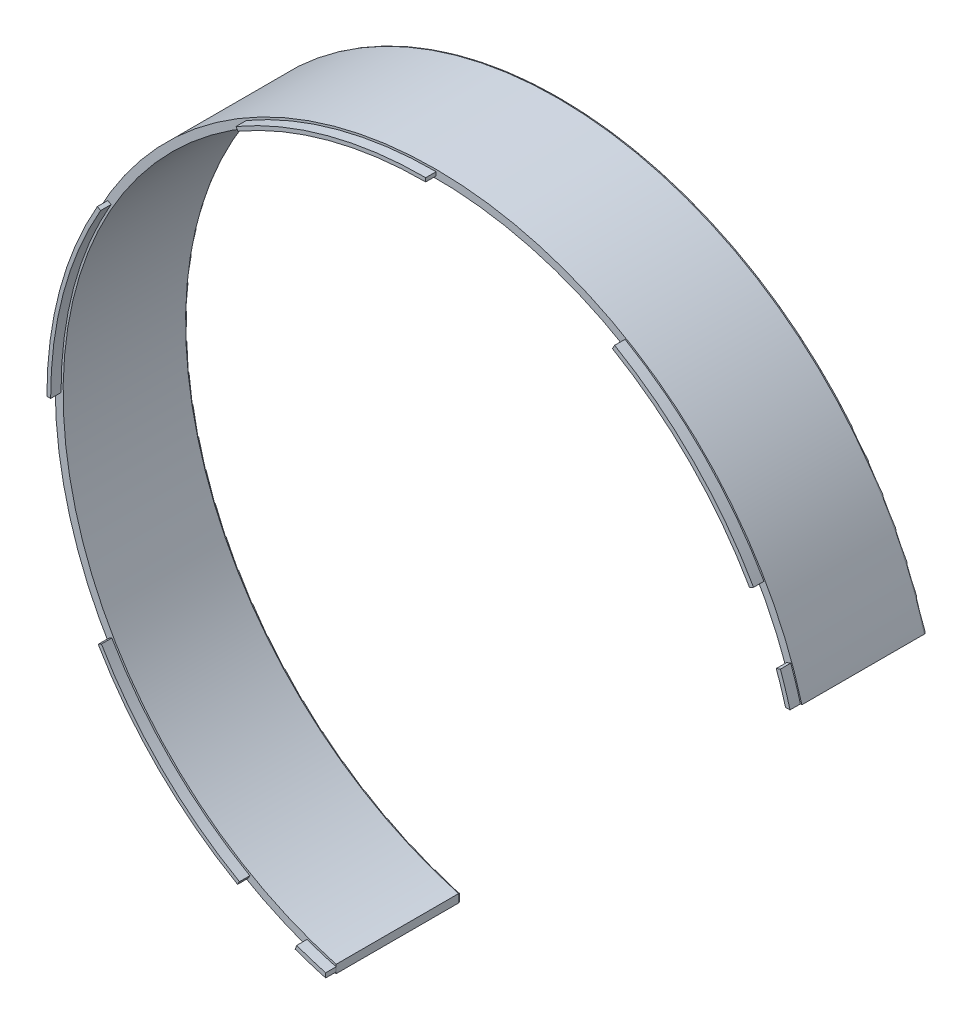
from build123d import *

# Parameters (mm, degrees)
BOSS_EXTRUDE1_DEPTH   = 5
BOSS_EXTRUDE1_2_DEPTH = 5
BOSS_EXTRUDE1_3_DEPTH = 5
BOSS_EXTRUDE1_4_DEPTH = 5
BOSS_EXTRUDE1_5_DEPTH = 5
BOSS_EXTRUDE1_6_DEPTH = 5
BOSS_EXTRUDE2_DEPTH   = 60
FILLET1_R             = 1
FILLET2_R             = 1


with BuildPart() as part:
    # Sketch1 → Boss-Extrude1 (new body)
    with BuildSketch(Plane.XY):
        with BuildLine():
            Line((158.382872448, 90.065008273), (156.470455766, 88.977505429))
            ThreePointArc((156.470455766, 88.977505429), (127.845298599, 126.710613707), (90.368878394, 155.671017912))
            Line((90.368878394, 155.671017912), (91.473386907, 157.573663687))
            ThreePointArc((91.473386907, 157.573663687), (129.407852249, 128.259298986), (158.382872448, 90.065008273))
        make_face()
    extrude(amount=-BOSS_EXTRUDE1_DEPTH)

    # Sketch2 → Boss-Extrude2 (add)
    with BuildSketch(Plane(origin=(0, 0, -5), x_dir=(-1, 0, 0), z_dir=(0, 0, -1))):
        with BuildLine():
            Line((47.7, -172.73491251), (47.7, -176.674021859))
            ThreePointArc((47.7, -176.674021859), (129.400540957, 129.400540957), (-176.674021859, 47.7))
            Line((-176.674021859, 47.7), (-172.73491251, 47.7))
            ThreePointArc((-172.73491251, 47.7), (126.713535189, 126.713535189), (47.7, -172.73491251))
        make_face()
    extrude(amount=BOSS_EXTRUDE2_DEPTH)

    # Fillet1
    fillet1_edges = [part.edges().sort_by_distance(p)[0] for p in [
        (-126.713535189, 126.713535189, -65),
        (-129.400540957, 129.400540957, -65),
        (174.704467185, 47.7, -65),
    ]]
    fillet(fillet1_edges, radius=FILLET1_R)

    # Fillet2
    # the kernel refuses this fillet: 1 mm, written as the material it takes off along each edge
    with BuildSketch(Plane(origin=(-47.7, -171.272370881, -65), x_dir=(0.0001000100005032703, 0, 0.9999999949989999), z_dir=(0, -1, 0))) as fillet2_piece_1:
        with BuildLine():
            CenterArc((0.999799995, 0.999999995), FILLET2_R, 180.005730151, 90)
            Line((-0.0002, 0.999899985), (-0.0202, 0.999897985))
            ThreePointArc((-0.0202, 0.999897985), (-0.02005, 0.499947997), (-0.02, -2e-06))
            Line((-0.02, -2e-06), (2e-06, -0.02))
            ThreePointArc((2e-06, -0.02), (0.499951998, -0.01995), (0.999902005, -0.02))
            Line((0.999902005, -0.02), (0.999900005, 0))
        make_face()
    extrude(amount=6.865387546, mode=Mode.SUBTRACT)


with BuildPart() as body_2:
    # Sketch1 → Boss-Extrude1 2 (new body)
    with BuildSketch(Plane.XY):
        with BuildLine():
            Line((169.319700725, 61.667486946), (171.292107151, 62.388332466))
            ThreePointArc((171.292107151, 62.388332466), (173.775741793, 55.093389478), (175.948856205, 47.7))
            Line((175.948856205, 47.7), (173.772120894, 47.7))
            ThreePointArc((173.772120894, 47.7), (171.688008284, 54.729039929), (169.319700725, 61.667486946))
        make_face()
    extrude(amount=-BOSS_EXTRUDE1_2_DEPTH)


with BuildPart() as body_3:
    # Sketch1 → Boss-Extrude1 3 (new body)
    with BuildSketch(Plane.XY):
        with BuildLine():
            Line((-90.895254799, 157.67705177), (-89.99457706, 156.118596265))
            ThreePointArc((-89.99457706, 156.118596265), (-46.351054078, 174.136784701), (0.474763766, 180.199374581))
            Line((0.474763766, 180.199374581), (0.481503909, 181.999363059))
            ThreePointArc((0.481503909, 181.999363059), (-46.814050179, 175.876219842), (-90.895254799, 157.67705177))
        make_face()
    extrude(amount=-BOSS_EXTRUDE1_3_DEPTH)


with BuildPart() as body_4:
    # Sketch1 → Boss-Extrude1 4 (new body)
    with BuildSketch(Plane.XY):
        with BuildLine():
            Line((-181.999363059, -0.481503909), (-180.199374581, -0.474763766))
            ThreePointArc((-180.199374581, -0.474763766), (-174.136784701, 46.351054078), (-156.118596265, 89.99457706))
            Line((-156.118596265, 89.99457706), (-157.67705177, 90.895254799))
            ThreePointArc((-157.67705177, 90.895254799), (-175.876219842, 46.814050179), (-181.999363059, -0.481503909))
        make_face()
    extrude(amount=-BOSS_EXTRUDE1_4_DEPTH)


with BuildPart() as body_5:
    # Sketch1 → Boss-Extrude1 5 (new body)
    with BuildSketch(Plane.XY):
        with BuildLine():
            Line((-90.139946119, -158.110056965), (-89.250170522, -156.545351454))
            ThreePointArc((-89.250170522, -156.545351454), (-126.851403278, -127.987348931), (-155.743479859, -90.642200335))
            Line((-155.743479859, -90.642200335), (-157.300190987, -91.54588967))
            ThreePointArc((-157.300190987, -91.54588967), (-128.118509415, -129.265801917), (-90.139946119, -158.110056965))
        make_face()
    extrude(amount=-BOSS_EXTRUDE1_5_DEPTH)


with BuildPart() as body_6:
    # Sketch1 → Boss-Extrude1 6 (new body)
    with BuildSketch(Plane.XY):
        with BuildLine():
            Line((-47.7, -173.772120894), (-47.7, -175.948856205))
            ThreePointArc((-47.7, -175.948856205), (-55.093389478, -173.775741793), (-62.388332466, -171.292107151))
            Line((-62.388332466, -171.292107151), (-61.667486946, -169.319700725))
            ThreePointArc((-61.667486946, -169.319700725), (-54.729039929, -171.688008284), (-47.7, -173.772120894))
        make_face()
    extrude(amount=-BOSS_EXTRUDE1_6_DEPTH)


solid = Compound([part.part, body_2.part, body_3.part, body_4.part, body_5.part, body_6.part])
